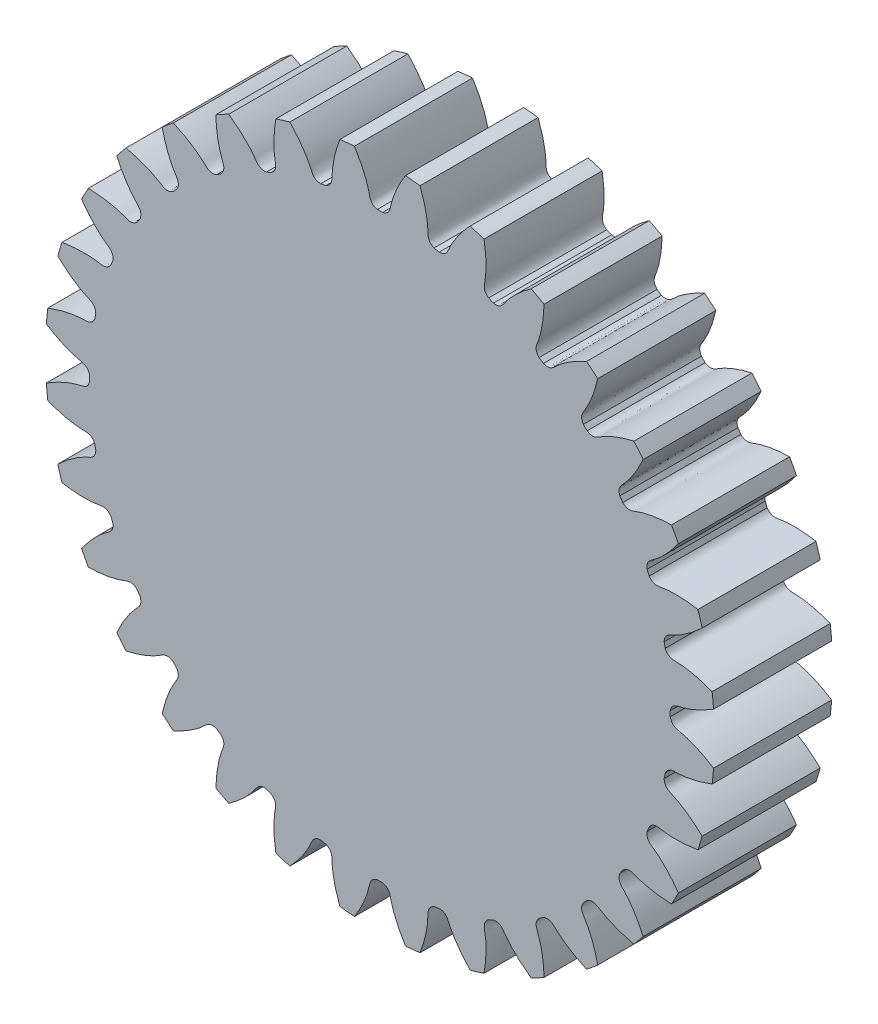
from build123d import *

# Parameters (mm, degrees)
SKETCH_1_R               = 8.5
EXTRUDE_1_DEPTH          = 3
CUT_EXTRUDE_1_DEPTH      = 13.389511693
PATTERN_CIRCULAR_1_COUNT = 32


with BuildPart() as part:
    # 草图1 → 凸台-拉伸1 (new body)
    with BuildSketch(Plane.XY):
        Circle(SKETCH_1_R)
    extrude(amount=EXTRUDE_1_DEPTH)

    # 草图2 → 切除-拉伸1 (cut, through all)
    with BuildSketch(Plane.XY):
        with BuildLine():
            ThreePointArc((0.067016057, 7.374695509), (0, 7.375), (-0.067016057, 7.374695509))
            add(Edge.make_bspline(
                [(-0.067016057, 7.374695509), (-0.244409752, 7.417585205), (-0.254185421, 7.546206625), (-0.286714327, 7.680381026), (-0.295183058, 7.71268082), (-0.305128683, 7.747692877), (-0.31664673, 7.785376713), (-0.32985255, 7.825680217), (-0.344853694, 7.868550436), (-0.361758143, 7.913930361), (-0.380671731, 7.961759942), (-0.401698795, 8.011975833), (-0.424941869, 8.064511528), (-0.450501667, 8.119297378), (-0.478476978, 8.176260642), (-0.508964584, 8.235325541), (-0.542059185, 8.296413305), (-0.577853311, 8.359442229), (-0.616437247, 8.424327727), (-0.657898954, 8.490982392), (-0.702323991, 8.559316051), (-0.749795443, 8.629235832), (-0.800393843, 8.700646224), (-0.854197106, 8.773449143), (-0.911280452, 8.847543999), (-0.971716342, 8.922827763), (-1.035574408, 8.999195043), (-1.102921392, 9.07653815), (-1.173821075, 9.154747175), (-1.248334222, 9.233710065), (-1.326518523, 9.313312698), (-1.40842851, 9.393438964), (-1.524138832, 9.502187768), (-1.614498649, 9.582084996), (-1.676516268, 9.63480345)],
                knots=[0, 0, 0, 0, 0.124532679, 0.135328735, 0.147193327, 0.160126453, 0.174128116, 0.189198313, 0.205337046, 0.222544314, 0.240820117, 0.260164456, 0.28057733, 0.302058739, 0.324608684, 0.348227164, 0.372914179, 0.39866973, 0.425493816, 0.453386438, 0.482347595, 0.512377287, 0.543475514, 0.575642277, 0.608877575, 0.643181408, 0.678553777, 0.714994681, 0.752504121, 0.791082096, 0.830728606, 0.871443651, 0.913227232, 1, 1, 1, 1], degree=3))
            ThreePointArc((-1.676516268, 9.63480345), (0, 9.779577922), (1.676516268, 9.63480345))
            add(Edge.make_bspline(
                [(0.067016057, 7.374695509), (0.244409752, 7.417585205), (0.254185421, 7.546206625), (0.286714327, 7.680381026), (0.295183058, 7.71268082), (0.305128683, 7.747692877), (0.31664673, 7.785376713), (0.32985255, 7.825680217), (0.344853694, 7.868550436), (0.361758143, 7.913930361), (0.380671731, 7.961759942), (0.401698795, 8.011975833), (0.424941869, 8.064511528), (0.450501667, 8.119297378), (0.478476978, 8.176260642), (0.508964584, 8.235325541), (0.542059185, 8.296413305), (0.577853311, 8.359442229), (0.616437247, 8.424327727), (0.657898954, 8.490982392), (0.702323991, 8.559316051), (0.749795443, 8.629235832), (0.800393843, 8.700646224), (0.854197106, 8.773449143), (0.911280452, 8.847543999), (0.971716342, 8.922827763), (1.035574408, 8.999195043), (1.102921392, 9.07653815), (1.173821075, 9.154747175), (1.248334222, 9.233710065), (1.326518523, 9.313312698), (1.40842851, 9.393438964), (1.524138832, 9.502187768), (1.614498649, 9.582084996), (1.676516268, 9.63480345)],
                knots=[0, 0, 0, 0, 0.124532679, 0.135328735, 0.147193327, 0.160126453, 0.174128116, 0.189198313, 0.205337046, 0.222544314, 0.240820117, 0.260164456, 0.28057733, 0.302058739, 0.324608684, 0.348227164, 0.372914179, 0.39866973, 0.425493816, 0.453386438, 0.482347595, 0.512377287, 0.543475514, 0.575642277, 0.608877575, 0.643181408, 0.678553777, 0.714994681, 0.752504121, 0.791082096, 0.830728606, 0.871443651, 0.913227232, 1, 1, 1, 1], degree=3))
        make_face()
    cut_extrude_1 = extrude(amount=CUT_EXTRUDE_1_DEPTH, mode=Mode.SUBTRACT)

    # 阵列(圆周)1: 切除-拉伸1 ×32 about axis
    pattern_circular_1_axis = Axis((0, 0, 3), (0, 0, -1))
    for i in range(1, PATTERN_CIRCULAR_1_COUNT):
        add(cut_extrude_1.rotate(pattern_circular_1_axis, i * 360 / PATTERN_CIRCULAR_1_COUNT), mode=Mode.SUBTRACT)


solid = part.part
